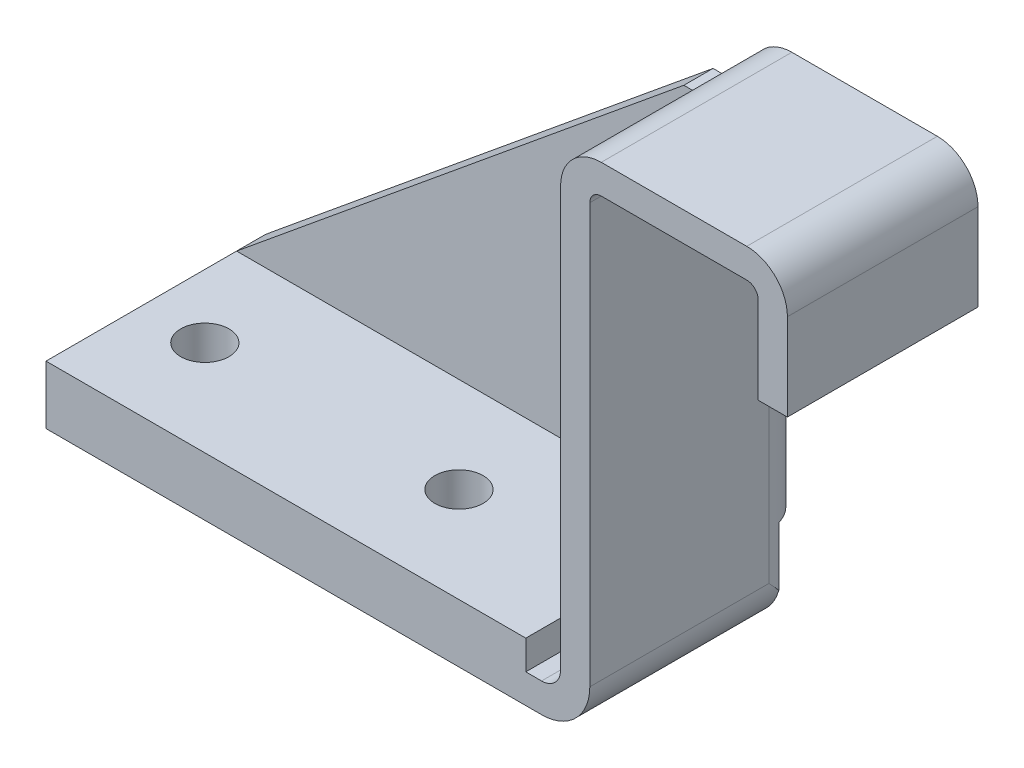
from build123d import *

# Parameters (mm, degrees)
EXTRUDE1_DEPTH     = 19.05
EXTRUDE4_DEPTH     = 2.921
SKETCH5_W          = 47.9552
SKETCH5_H          = 2.921
EXTRUDE5_DEPTH     = 19.05
FILLET1_R          = 4.064
FILLET2_START      = 790
FILLET2_2_DEPTH    = 44.1360001
SKETCH6_R          = 2.413
CUT_EXTRUDE1_DEPTH = 5.842


with BuildPart() as part:
    # Sketch2 → Extrude1 (new body)
    with BuildSketch(Plane.XY):
        with BuildLine():
            Line((356.4255, 790.321), (306.8955, 790.321))
            Line((306.8955, 790.321), (306.8955, 787.4))
            Line((306.8955, 787.4), (356.4255, 787.4))
            ThreePointArc((356.4255, 787.4), (359.837997326, 788.813502674), (361.2515, 792.226))
            Line((361.2515, 792.226), (361.2515, 834.136))
            ThreePointArc((361.2515, 834.136), (361.586276949, 834.944223051), (362.3945, 835.279))
            Line((362.3945, 835.279), (376.936, 835.279))
            ThreePointArc((376.936, 835.279), (377.744223051, 834.944223051), (378.079, 834.136))
            Line((378.079, 834.136), (378.079, 825.4492))
            Line((378.079, 825.4492), (381, 825.4492))
            Line((381, 825.4492), (381, 834.136))
            ThreePointArc((381, 834.136), (379.809681959, 837.009681959), (376.936, 838.2))
            Line((376.936, 838.2), (362.3945, 838.2))
            ThreePointArc((362.3945, 838.2), (359.520818041, 837.009681959), (358.3305, 834.136))
            Line((358.3305, 834.136), (358.3305, 792.226))
            ThreePointArc((358.3305, 792.226), (357.772538418, 790.878961582), (356.4255, 790.321))
        make_face()
    extrude(amount=EXTRUDE1_DEPTH)



with BuildPart() as body_2:
    # Sketch3 → Extrude4 (new body)
    with BuildSketch(Plane.XY):
        Polygon((306.8955, 793.242), (351.5995, 829.945), (361.2515, 829.945), (361.2515, 796.82051965), (354.8507, 796.82051965), (354.8507, 790.321), (306.8955, 790.321), align=None)
    extrude(amount=-EXTRUDE4_DEPTH)


with BuildPart() as part_1:
    add(part.part)

    add(body_2.part)  # Extrude5 merges body 2
    # Sketch5 → Extrude5 (add)
    with BuildSketch(Plane.XY):
        with Locations((330.8731, 791.7815)):
            Rectangle(SKETCH5_W, SKETCH5_H)
    extrude(amount=EXTRUDE5_DEPTH)

    # Fillet1
    # the kernel refuses this fillet: 4.064 mm, written as the material it takes off along each edge
    with BuildSketch(Plane(origin=(364.600586858, 790.321, -2.921), x_dir=(0, 0, 1), z_dir=(-1, 0, 0))) as fillet1_piece_1:
        with BuildLine():
            CenterArc((4.064, 3.899954743), FILLET1_R, 180, 73.665177219)
            Line((0, 3.899954743), (-0.08128, 3.899954743))
            Line((-0.08128, 3.899954743), (-0.08128, 0))
            Line((-0.08128, 0), (0, -0.08128))
            ThreePointArc((0, -0.08128), (1.4605, -0.08128), (2.89814, -0.077999095))
            Line((2.89814, -0.077999095), (2.921, 0))
        make_face()
    extrude(amount=67.454973717, mode=Mode.SUBTRACT)

    # Fillet2: read off the stored shape, not the designer's step
    # Fillet2 outline → Fillet2 (revolve, cut)
    with BuildSketch(Plane(origin=(362.3945, 834.136, 0), x_dir=(1, 0, 0), z_dir=(0, -1, 0))):
        with BuildLine():
            Line((1.143, 0), (1.307045257, 0))
            ThreePointArc((1.307045257, 0), (1.184220359, 0.565643991), (1.143, 1.143))
            Line((1.143, 1.143), (1.143, 0))
        make_face()
    revolve(axis=Axis((362.3945, 834.136, 0), (0, 0, 1)), mode=Mode.SUBTRACT)

    # Fillet2 2 outline → Fillet2 2 (cut)
    with BuildSketch(Plane(origin=(0, 0, 0), x_dir=(1, 0, 0), z_dir=(0, 1, 0)).offset(FILLET2_START)):
        with BuildLine():
            Line((361.2515, 2.921), (357.1875, 2.921))
            ThreePointArc((357.1875, 2.921), (360.061181959, 1.730681959), (361.2515, -1.143))
            Line((361.2515, -1.143), (361.2515, 2.921))
        make_face()
    extrude(amount=FILLET2_2_DEPTH, mode=Mode.SUBTRACT)

    # Sketch6 → Cut-Extrude1 (cut)
    with BuildSketch(Plane.XZ.offset(-787.4)):
        with Locations(Location((313.2455, 9.525, 0), (0, 0, 270))):
            Circle(SKETCH6_R)
        with Locations(Location((338.6455, 9.525, 0), (0, 0, 270))):
            Circle(SKETCH6_R)
    extrude(amount=-CUT_EXTRUDE1_DEPTH, mode=Mode.SUBTRACT)


solid = part_1.part
